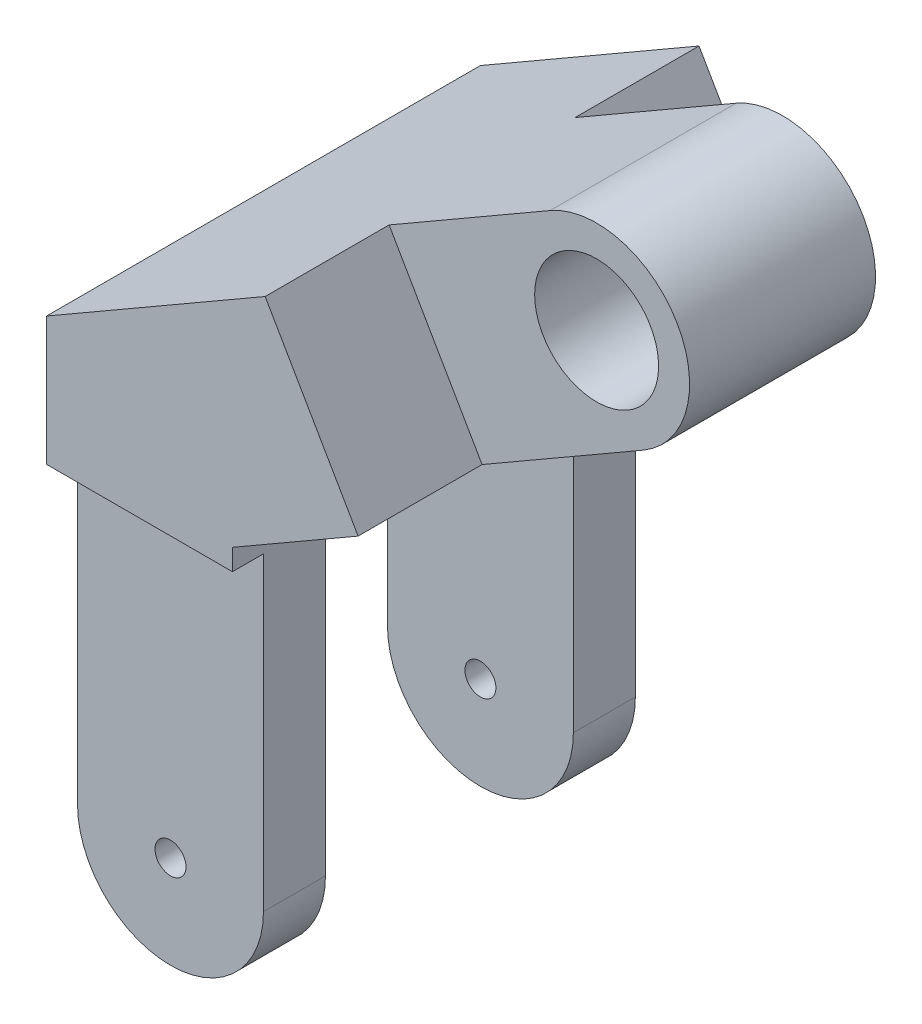
from build123d import *

# Parameters (mm, degrees)
SKETCH_1_R          = 2.5
SKETCH_1_R_2        = 10
EXTRUDE_1_DEPTH     = 70
SKETCH_2_W          = 60
SKETCH_2_H          = 30
CUT_EXTRUDE_1_DEPTH = 70
SKETCH_3_W          = 40
SKETCH_3_H          = 70
SKETCH_3_W_2        = 20
CUT_EXTRUDE_2_DEPTH = 70


with BuildPart() as part:
    # 草图1 → 凸台-拉伸1 (new body)
    with BuildSketch(Plane.XY):
        with BuildLine():
            Line((-15, 0), (-15, 70.725407976))
            Line((-15, 70.725407976), (46.25, 106.088111964))
            ThreePointArc((46.25, 106.088111964), (66.740381057, 100.597730907), (61.25, 80.10734985))
            Line((61.25, 80.10734985), (15, 53.4048999))
            Line((15, 53.4048999), (15, 0))
            ThreePointArc((15, 0), (0, -15), (-15, 0))
        make_face()
        Circle(SKETCH_1_R, mode=Mode.SUBTRACT)
        with Locations((53.75, 93.097730907)):
            Circle(SKETCH_1_R_2, mode=Mode.SUBTRACT)
    extrude(amount=EXTRUDE_1_DEPTH)

    # 草图2 → 切除-拉伸1 (cut)
    with BuildSketch(Plane(origin=(-34.375, 59.53924651, 0), x_dir=(0.8660254037844327, 0.5000000000000104, 0), z_dir=(-0.5000000000000104, 0.8660254037844327, 0))):
        with Locations((93.097730907, -5)):
            Rectangle(SKETCH_2_W, SKETCH_2_H)
        with Locations((93.097730907, -65)):
            Rectangle(SKETCH_2_W, SKETCH_2_H)
    extrude(amount=-CUT_EXTRUDE_1_DEPTH, mode=Mode.SUBTRACT)

    # 草图3 → 切除-拉伸2 (cut)
    with BuildSketch(Plane(origin=(15, 0, 0), x_dir=(0, 0, -1), z_dir=(1, 0, 0))):
        with Locations((-35, 15)):
            Rectangle(SKETCH_3_W, SKETCH_3_H)
        with Locations((5, 15)):
            Rectangle(SKETCH_3_W_2, SKETCH_3_H)
        with Locations((-75, 15)):
            Rectangle(SKETCH_3_W_2, SKETCH_3_H)
    extrude(amount=-CUT_EXTRUDE_2_DEPTH, mode=Mode.SUBTRACT)


solid = part.part
